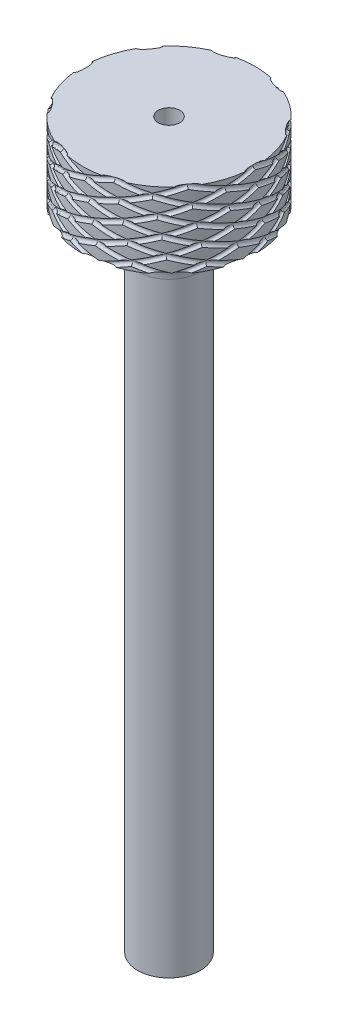
from build123d import *

# Parameters (mm, degrees)
SKETCH1_R           = 2.9
BOSS_EXTRUDE1_DEPTH = 60
SKETCH2_R           = 8
BOSS_EXTRUDE2_DEPTH = 7
SKETCH7_R           = 1
CUT_EXTRUDE1_DEPTH  = 67
FILLET1_R           = 4
CUT_SWEEP2_PITCH    = 15
CIRPATTERN2_COUNT   = 10
CUT_SWEEP4_PITCH    = 17
CIRPATTERN3_COUNT   = 10


with BuildPart() as part:
    # Sketch1 → Boss-Extrude1 (new body)
    with BuildSketch(Plane(origin=(0, 0, 0), x_dir=(1, 0, 0), z_dir=(0, 1, 0))):
        with Locations(Location((0, 0, 0), (0, 0, 270))):
            Circle(SKETCH1_R)
    extrude(amount=BOSS_EXTRUDE1_DEPTH)

    # Sketch2 → Boss-Extrude2 (add)
    with BuildSketch(Plane(origin=(0, 60, 0), x_dir=(1, 0, 0), z_dir=(0, 1, 0))):
        with Locations(Location((0, 0, 0), (0, 0, 270))):
            Circle(SKETCH2_R)
    extrude(amount=BOSS_EXTRUDE2_DEPTH)

    # Sketch7 → Cut-Extrude1 (cut)
    with BuildSketch(Plane.XZ):
        with Locations(Location((0, 0, 0), (0, 0, 270))):
            Circle(SKETCH7_R)
    extrude(amount=-CUT_EXTRUDE1_DEPTH, mode=Mode.SUBTRACT)

    # Fillet1
    fillet1_edges = [part.edges().sort_by_distance(p)[0] for p in [
        (0, 60, -2.9),
    ]]
    fillet(fillet1_edges, radius=FILLET1_R)

    # Cut-Sweep2: arcs per turn and ends read off the stored shape
    # Cut-Sweep2: the profile of Cut-Sweep2 profile screwed along a left-hand helix through 2 turns, 18 arcs to a turn; built about Z, then put on its axis
    cut_sweep2_z = Axis((0, 0, 0), (0, 0, 1))
    cut_sweep2_corners = [(8, -0.071488657, -15.23956079), (8.25, 0, -15), (8, 0.071488657, -14.76043921), (7.75, 0, -15)]
    with BuildLine(mode=Mode.PRIVATE) as cut_sweep2_profile:
        ThreePointArc((8, -0.071488657, -15.23956079), (8.176776695, -0.050550114, -15.169395059), (8.25, 0, -15))
        ThreePointArc((8.25, 0, -15), (8.176776695, 0.050550114, -14.830604941), (8, 0.071488657, -14.76043921))
        ThreePointArc((8, 0.071488657, -14.76043921), (7.823223305, 0.050550114, -14.830604941), (7.75, 0, -15))
        ThreePointArc((7.75, 0, -15), (7.823223305, -0.050550114, -15.169395059), (8, -0.071488657, -15.23956079))
    cut_sweep2_cap = Face(cut_sweep2_profile.wire())
    cut_sweep2_arcs = [((8, -0.071488657, -15.23956079), (8.25, -0.071488657, -15.23956079), (8.25, 0, -15), (1, 0.7071067811865476, 1)), ((8.25, 0, -15), (8.25, 0.071488657, -14.76043921), (8, 0.071488657, -14.76043921), (1, 0.7071067811865476, 1)), ((8, 0.071488657, -14.76043921), (7.75, 0.071488657, -14.76043921), (7.75, 0, -15), (1, 0.7071067811865476, 1)), ((7.75, 0, -15), (7.75, -0.071488657, -15.23956079), (8, -0.071488657, -15.23956079), (1, 0.7071067811865476, 1))]  # start, shoulder, end, weights
    cut_sweep2_turn_angles = [0, -10, -20, -30, -40, -50, -60, -70, -80, -90, -100, -110, -120, -130, -140, -150, -160, -170, -180, -190, -200, -210, -220, -230, -240, -250, -260, -270, -280, -290, -300, -310, -320, -330, -340, -350, -360]
    cut_sweep2_turn_weights = [1, 0.984807753012208, 1, 0.984807753012208, 1, 0.984807753012208, 1, 0.984807753012208, 1, 0.984807753012208, 1, 0.984807753012208, 1, 0.984807753012208, 1, 0.984807753012208, 1, 0.984807753012208, 1, 0.984807753012208, 1, 0.984807753012208, 1, 0.984807753012208, 1, 0.984807753012208, 1, 0.984807753012208, 1, 0.984807753012208, 1, 0.984807753012208, 1, 0.984807753012208, 1, 0.984807753012208, 1]
    cut_sweep2_turn_sides = [Face.make_bezier_surface([[Vector(p[j][0], p[j][1], 0).rotate(cut_sweep2_z, cut_sweep2_turn_angles[2 * i + k]) / cut_sweep2_turn_weights[2 * i + k] + Vector(0, 0, p[j][2] + -CUT_SWEEP2_PITCH * cut_sweep2_turn_angles[2 * i + k] / 360) for k in range(3)] for j in range(3)], [[p[3][j] * cut_sweep2_turn_weights[2 * i + k] for k in range(3)] for j in range(3)]) for p in cut_sweep2_arcs for i in range(18)]
    cut_sweep2 = Plane(origin=(0, 67, 0), x_dir=(-1, 0, 0), z_dir=(0, -1, 0)) * Solid(Shell([*[p.moved(Location((0, 0, CUT_SWEEP2_PITCH * i))) for i in range(2) for p in cut_sweep2_turn_sides], cut_sweep2_cap, cut_sweep2_cap.rotate(cut_sweep2_z, -720).moved(Location((0, 0, -CUT_SWEEP2_PITCH * -720 / 360)))]))
    add(cut_sweep2, mode=Mode.SUBTRACT)

    # CirPattern2: Cut-Sweep2 ×10 about axis
    cirpattern2_axis = Axis((0, 69.828427125, 0), (0, -1, 0))
    for i in range(1, CIRPATTERN2_COUNT):
        add(cut_sweep2.rotate(cirpattern2_axis, i * 360 / CIRPATTERN2_COUNT), mode=Mode.SUBTRACT)

    # Cut-Sweep4: arcs per turn and ends read off the stored shape
    # Cut-Sweep4: the profile of Cut-Sweep4 profile screwed along a right-hand helix through 1 turns, 18 arcs to a turn; built about Z, then put on its axis
    cut_sweep4_z = Axis((0, 0, 0), (0, 0, 1))
    cut_sweep4_corners = [(8, -0.080094373, 0.236822489), (8.25, 0, 0), (8, 0.080094373, -0.236822489), (7.75, 0, 0)]
    with BuildLine(mode=Mode.PRIVATE) as cut_sweep4_profile:
        ThreePointArc((8, -0.080094373, 0.236822489), (8.176776695, -0.056635274, 0.167458788), (8.25, 0, 0))
        ThreePointArc((8.25, 0, 0), (8.176776695, 0.056635274, -0.167458788), (8, 0.080094373, -0.236822489))
        ThreePointArc((8, 0.080094373, -0.236822489), (7.823223305, 0.056635274, -0.167458788), (7.75, 0, 0))
        ThreePointArc((7.75, 0, 0), (7.823223305, -0.056635274, 0.167458788), (8, -0.080094373, 0.236822489))
    cut_sweep4_cap = Face(cut_sweep4_profile.wire())
    cut_sweep4_arcs = [((8, -0.080094373, 0.236822489), (8.25, -0.080094373, 0.236822489), (8.25, 0, 0), (1, 0.7071067811865476, 1)), ((8.25, 0, 0), (8.25, 0.080094373, -0.236822489), (8, 0.080094373, -0.236822489), (1, 0.7071067811865476, 1)), ((8, 0.080094373, -0.236822489), (7.75, 0.080094373, -0.236822489), (7.75, 0, 0), (1, 0.7071067811865476, 1)), ((7.75, 0, 0), (7.75, -0.080094373, 0.236822489), (8, -0.080094373, 0.236822489), (1, 0.7071067811865476, 1))]  # start, shoulder, end, weights
    cut_sweep4_turn_angles = [0, 10, 20, 30, 40, 50, 60, 70, 80, 90, 100, 110, 120, 130, 140, 150, 160, 170, 180, 190, 200, 210, 220, 230, 240, 250, 260, 270, 280, 290, 300, 310, 320, 330, 340, 350, 360]
    cut_sweep4_turn_weights = [1, 0.984807753012208, 1, 0.984807753012208, 1, 0.984807753012208, 1, 0.984807753012208, 1, 0.984807753012208, 1, 0.984807753012208, 1, 0.984807753012208, 1, 0.984807753012208, 1, 0.984807753012208, 1, 0.984807753012208, 1, 0.984807753012208, 1, 0.984807753012208, 1, 0.984807753012208, 1, 0.984807753012208, 1, 0.984807753012208, 1, 0.984807753012208, 1, 0.984807753012208, 1, 0.984807753012208, 1]
    cut_sweep4_turn_sides = [Face.make_bezier_surface([[Vector(p[j][0], p[j][1], 0).rotate(cut_sweep4_z, cut_sweep4_turn_angles[2 * i + k]) / cut_sweep4_turn_weights[2 * i + k] + Vector(0, 0, p[j][2] + CUT_SWEEP4_PITCH * cut_sweep4_turn_angles[2 * i + k] / 360) for k in range(3)] for j in range(3)], [[p[3][j] * cut_sweep4_turn_weights[2 * i + k] for k in range(3)] for j in range(3)]) for p in cut_sweep4_arcs for i in range(18)]
    cut_sweep4 = Plane(origin=(0, 67, 0), x_dir=(-1, 0, 0), z_dir=(0, -1, 0)) * Solid(Shell([*cut_sweep4_turn_sides, cut_sweep4_cap, cut_sweep4_cap.rotate(cut_sweep4_z, 360).moved(Location((0, 0, CUT_SWEEP4_PITCH * 360 / 360)))]))
    add(cut_sweep4, mode=Mode.SUBTRACT)

    # CirPattern3: Cut-Sweep4 ×10 about axis
    cirpattern3_axis = Axis((0, 69.828427125, 0), (0, -1, 0))
    for i in range(1, CIRPATTERN3_COUNT):
        add(cut_sweep4.rotate(cirpattern3_axis, i * 360 / CIRPATTERN3_COUNT), mode=Mode.SUBTRACT)


solid = part.part
